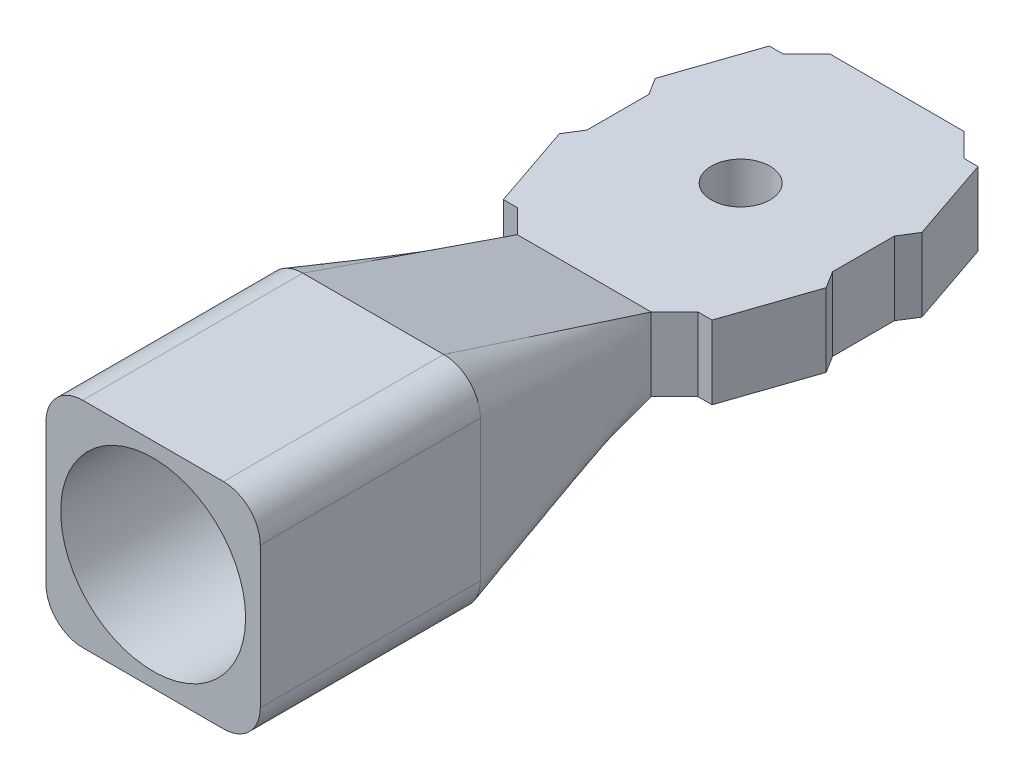
from build123d import *

# Parameters (mm, degrees)
SKETCH8_R           = 4
BOSS_EXTRUDE1_DEPTH = 10
SKETCH10_R          = 12.6
BOSS_EXTRUDE2_DEPTH = 30


with BuildPart() as part:
    # Sketch8 → Boss-Extrude1 (new body)
    with BuildSketch(Plane(origin=(0, 0, 0), x_dir=(1, 0, 0), z_dir=(0, 1, 0))):
        Polygon((-9.12527543, 21.31491274), (9.12527543, 21.31491274), (12.319319476, 18.120868694), (14.223486177, 18.120868694), (18.172090162, 6.522951249), (16.725571871, 4.216341001), (16.725571871, -4.216341001), (18.172090162, -6.522951249), (14.223486177, -18.120868694), (12.319319476, -18.120868694), (9.12527543, -21.31491274), (-9.12527543, -21.31491274), (-12.319319476, -18.120868694), (-14.223486177, -18.120868694), (-18.172090162, -6.522951249), (-16.725571871, -4.216341001), (-16.725571871, 4.216341001), (-18.172090162, 6.522951249), (-14.223486177, 18.120868694), (-12.319319476, 18.120868694), align=None)
        with Locations(Location((0, 0, 0), (0, 0, 270))):
            Circle(SKETCH8_R, mode=Mode.SUBTRACT)
    extrude(amount=BOSS_EXTRUDE1_DEPTH)

    # Loft1: read off the stored shape, not the designer's step
    # Loft1: loft between two sections, ruled curve by curve
    loft1_from = [
        Edge.make_bspline([(-9.12527543, 10, 21.31491274), (-9.12527543, 9.765382388, 21.31491274), (-9.12527543, 9.312631807, 21.31491274), (-9.12527543, 8.654210049, 21.31491274), (-9.12527543, 7.995788292, 21.31491274), (-9.12527543, 7.54303771, 21.31491274), (-9.12527543, 6.709704377, 21.31491274), (-9.12527543, 5.497189101, 21.31491274), (-9.12527543, 3.654210049, 21.31491274), (-9.12527543, 1.811230997, 21.31491274), (-9.12527543, 0.598715722, 21.31491274), (-9.12527543, 0, 21.31491274)], [0, 0, 0, 0, 0.070385284, 0.140770567, 0.211155851, 0.281541134, 0.281541134, 0.461155851, 0.640770567, 0.820385284, 1, 1, 1, 1], 3),
        Edge.make_bspline([(-9.12527543, 0, 21.31491274), (-8.701884774, 0, 21.31491274), (-7.877185435, 0, 21.31491274), (-6.669134636, 0, 21.31491274), (-5.461083837, 0, 21.31491274), (-4.636384498, 0, 21.31491274), (-3.11550526, 0, 21.31491274), (-0.899875875, 0, 21.31491274), (2.456140795, 0, 21.31491274), (5.812157464, 0, 21.31491274), (8.027786849, 0, 21.31491274), (9.12527543, 0, 21.31491274)], [0, 0, 0, 0, 0.069596363, 0.139192727, 0.20878909, 0.278385454, 0.278385454, 0.45878909, 0.639192727, 0.819596363, 1, 1, 1, 1], 3),
        Edge.make_bspline([(9.12527543, 0, 21.31491274), (9.12527543, 0.176730026, 21.31491274), (9.12527543, 0.525998676, 21.31491274), (9.12527543, 1.046828191, 21.31491274), (9.12527543, 1.573509956, 21.31491274), (9.12527543, 1.935115843, 21.31491274), (9.12527543, 2.59171915, 21.31491274), (9.12527543, 3.546633632, 21.31491274), (9.12527543, 5, 21.31491274), (9.12527543, 6.453366368, 21.31491274), (9.12527543, 7.40828085, 21.31491274), (9.12527543, 8.064884157, 21.31491274), (9.12527543, 8.426490044, 21.31491274), (9.12527543, 8.953171809, 21.31491274), (9.12527543, 9.474001324, 21.31491274), (9.12527543, 9.823269974, 21.31491274), (9.12527543, 10, 21.31491274)], [0, 0, 0, 0, 0.055103878, 0.110207755, 0.165311633, 0.22041551, 0.22041551, 0.360207755, 0.5, 0.639792245, 0.77958449, 0.77958449, 0.834688367, 0.889792245, 0.944896122, 1, 1, 1, 1], 3),
        Edge.make_line((-9.12527543, 10, 21.31491274), (9.12527543, 10, 21.31491274)),
    ]
    loft1_to = [
        Edge.make_bspline([(-9.6, 19.6, 50.06820098), (-10.234734052, 19.6, 50.06820098), (-11.53398235, 19.354031687, 50.06820098), (-13.231668825, 18.231668825, 50.06820098), (-14.354031687, 16.53398235, 50.06820098), (-14.6, 15.234734052, 50.06820098), (-14.6, 12.980235586, 50.06820098), (-14.6, 9.770888451, 50.06820098), (-14.6, 5, 50.06820098), (-14.6, 0.229111549, 50.06820098), (-14.6, -2.980235586, 50.06820098), (-14.6, -4.6, 50.06820098)], [0, 0, 0, 0, 0.070385284, 0.140770567, 0.211155851, 0.281541134, 0.281541134, 0.461155851, 0.640770567, 0.820385284, 1, 1, 1, 1], 3),
        Edge.make_bspline([(-14.6, -4.6, 50.06820098), (-14.6, -5.227619575, 50.06820098), (-14.359276005, -6.522715506, 50.06820098), (-13.233267962, -8.233267962, 50.06820098), (-11.522715506, -9.359276005, 50.06820098), (-10.227619575, -9.6, 50.06820098), (-7.97312111, -9.6, 50.06820098), (-4.760666779, -9.6, 50.06820098), (0, -9.6, 50.06820098), (4.760666779, -9.6, 50.06820098), (7.97312111, -9.6, 50.06820098), (9.6, -9.6, 50.06820098)], [0, 0, 0, 0, 0.069596363, 0.139192727, 0.20878909, 0.278385454, 0.278385454, 0.45878909, 0.639192727, 0.819596363, 1, 1, 1, 1], 3),
        Edge.make_bspline([(9.6, -9.6, 50.06820098), (10.254498465, -9.6, 50.06820098), (11.572560966, -9.339055686, 50.06820098), (13.250251726, -8.208250929, 50.06820098), (14.352747808, -6.529386239, 50.06820098), (14.6, -5.237424723, 50.06820098), (14.6, -2.982926258, 50.06820098), (14.6, 0.22521062, 50.06820098), (14.6, 5, 50.06820098), (14.6, 9.77478938, 50.06820098), (14.6, 12.982926258, 50.06820098), (14.6, 15.237424723, 50.06820098), (14.352747808, 16.529386239, 50.06820098), (13.250251726, 18.208250929, 50.06820098), (11.572560966, 19.339055686, 50.06820098), (10.254498465, 19.6, 50.06820098), (9.6, 19.6, 50.06820098)], [0, 0, 0, 0, 0.055103878, 0.110207755, 0.165311633, 0.22041551, 0.22041551, 0.360207755, 0.5, 0.639792245, 0.77958449, 0.77958449, 0.834688367, 0.889792245, 0.944896122, 1, 1, 1, 1], 3),
        Edge.make_line((-9.6, 19.6, 50.06820098), (9.6, 19.6, 50.06820098)),
    ]
    loft1 = Solid(Shell([*[Face.make_surface_from_curves(loft1_from[k], loft1_to[k]) for k in range(4)], Face(Wire(loft1_from)), Face(Wire(loft1_to))]))
    add(loft1)

    # Sketch10 → Boss-Extrude2 (add)
    with BuildSketch(Plane.XY.offset(50.06820098)):
        with BuildLine():
            Line((-9.6, -9.6), (9.6, -9.6))
            ThreePointArc((9.6, -9.6), (13.135533906, -8.135533906), (14.6, -4.6))
            Line((14.6, -4.6), (14.6, 14.6))
            ThreePointArc((14.6, 14.6), (13.135533906, 18.135533906), (9.6, 19.6))
            Line((9.6, 19.6), (-9.6, 19.6))
            ThreePointArc((-9.6, 19.6), (-13.135533906, 18.135533906), (-14.6, 14.6))
            Line((-14.6, 14.6), (-14.6, -4.6))
            ThreePointArc((-14.6, -4.6), (-13.135533906, -8.135533906), (-9.6, -9.6))
        make_face()
        with Locations((0, 5)):
            Circle(SKETCH10_R, mode=Mode.SUBTRACT)
    extrude(amount=BOSS_EXTRUDE2_DEPTH)


solid = part.part
